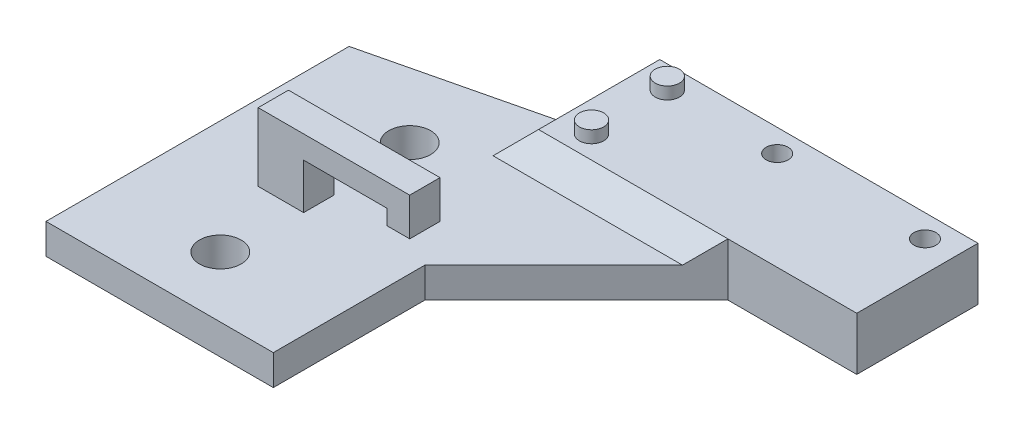
from build123d import *

# Parameters (mm, degrees)
SKETCH1_W           = 42
SKETCH1_H           = 16
BOSS_EXTRUDE1_DEPTH = 7
SKETCH2_R           = 1.6
BOSS_EXTRUDE2_DEPTH = 1.6
CUT_EXTRUDE1_REACH  = 26.062
SKETCH3_R           = 1.45
BOSS_EXTRUDE6_DEPTH = 4
CUT_EXTRUDE2_REACH  = 69.037
SKETCH8_R           = 2.75
BOSS_EXTRUDE7_DEPTH = 2
CHAMFER2_SIZE       = 3


with BuildPart() as part:
    # Sketch1 → Boss-Extrude1 (new body)
    with BuildSketch(Plane(origin=(0, 0, 0), x_dir=(1, 0, 0), z_dir=(0, 1, 0))):
        Rectangle(SKETCH1_W, SKETCH1_H)
    extrude(amount=BOSS_EXTRUDE1_DEPTH)

    # Sketch2 → Boss-Extrude2 (add)
    with BuildSketch(Plane(origin=(0, 7, 0), x_dir=(1, 0, 0), z_dir=(0, 1, 0))):
        with Locations(Location((-17, 5, 0), (0, 0, 270))):
            Circle(SKETCH2_R)
        with Locations(Location((-17, -5, 0), (0, 0, 270))):
            Circle(SKETCH2_R)
    extrude(amount=BOSS_EXTRUDE2_DEPTH)

    # Sketch3 → Cut-Extrude1 (cut, up to next)
    with BuildSketch(Plane(origin=(0, 0, 0), x_dir=(1, 0, 0), z_dir=(0, 1, 0)), mode=Mode.PRIVATE) as cut_extrude1_sk1:
        with Locations(Location((-2.5, 5, 0), (0, 0, 270))):
            Circle(SKETCH3_R)
    cut_extrude1_tool1 = extrude(cut_extrude1_sk1.sketch, amount=CUT_EXTRUDE1_REACH, mode=Mode.PRIVATE) & part.part
    # Sketch3 → Cut-Extrude1 (cut, up to next)
    with BuildSketch(Plane(origin=(0, 0, 0), x_dir=(1, 0, 0), z_dir=(0, 1, 0)), mode=Mode.PRIVATE) as cut_extrude1_sk2:
        with Locations(Location((17, 5, 0), (0, 0, 270))):
            Circle(SKETCH3_R)
    cut_extrude1_tool2 = extrude(cut_extrude1_sk2.sketch, amount=CUT_EXTRUDE1_REACH, mode=Mode.PRIVATE) & part.part
    add(cut_extrude1_tool1.solids().sort_by_distance((-2.5, 0, -5))[0], mode=Mode.SUBTRACT)
    add(cut_extrude1_tool2.solids().sort_by_distance((17, 0, -5))[0], mode=Mode.SUBTRACT)

    # Sketch7 → Boss-Extrude6 (add)
    with BuildSketch(Plane(origin=(0, 0, 0), x_dir=(1, 0, 0), z_dir=(0, 1, 0))):
        Polygon((-21, -2), (-46, -8), (-46, -48), (-16, -48), (-16, -28), (4, -8), (-21, -8), align=None)
    extrude(amount=BOSS_EXTRUDE6_DEPTH)

    # Sketch8 → Cut-Extrude2 (cut, up to next)
    with BuildSketch(Plane(origin=(0, 0, 0), x_dir=(1, 0, 0), z_dir=(0, 1, 0)), mode=Mode.PRIVATE) as cut_extrude2_sk1:
        with Locations(Location((-31, -40, 0), (0, 0, 90))):
            Circle(SKETCH8_R)
    cut_extrude2_tool1 = extrude(cut_extrude2_sk1.sketch, amount=CUT_EXTRUDE2_REACH, mode=Mode.PRIVATE) & part.part
    # Sketch8 → Cut-Extrude2 (cut, up to next)
    with BuildSketch(Plane(origin=(0, 0, 0), x_dir=(1, 0, 0), z_dir=(0, 1, 0)), mode=Mode.PRIVATE) as cut_extrude2_sk2:
        with Locations(Location((-31, -15, 0), (0, 0, 90))):
            Circle(SKETCH8_R)
    cut_extrude2_tool2 = extrude(cut_extrude2_sk2.sketch, amount=CUT_EXTRUDE2_REACH, mode=Mode.PRIVATE) & part.part
    add(cut_extrude2_tool1.solids().sort_by_distance((-31, 0, 40))[0], mode=Mode.SUBTRACT)
    add(cut_extrude2_tool2.solids().sort_by_distance((-31, 0, 15))[0], mode=Mode.SUBTRACT)

    # Sketch9 → Boss-Extrude7 (add, symmetric)
    with BuildSketch(Plane.XY.offset(28)):
        Polygon((-36, 4), (-36, 13), (-16, 13), (-16, 8), (-19, 8), (-19, 10), (-30, 10), (-30, 4), align=None)
    extrude(amount=BOSS_EXTRUDE7_DEPTH, both=True)

    # Chamfer2
    chamfer2_edges = [part.edges().sort_by_distance(p)[0] for p in [
        (-21, 4, 5),
        (-8.5, 4, 8),
    ]]
    chamfer(chamfer2_edges, length=CHAMFER2_SIZE - 0.0001)  # a hair under: the kernel refuses the full size


solid = part.part
